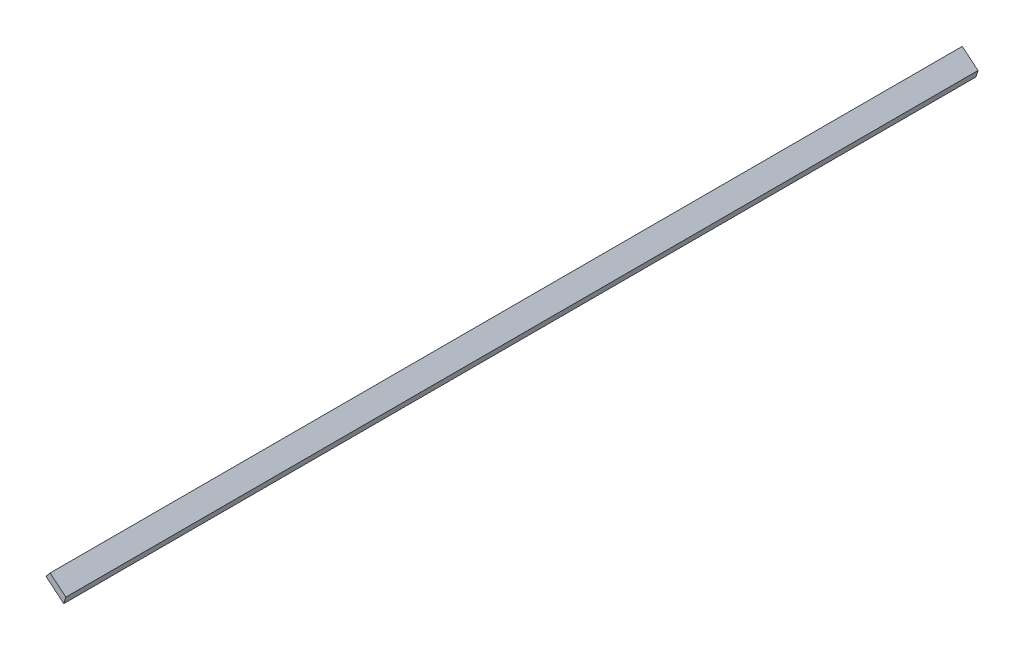
from build123d import *

# Parameters (mm, degrees)
BOSS_EXTRUDE1_DEPTH = 895.35


with BuildPart() as part:
    # Sketch1 → Boss-Extrude1 (new body)
    with BuildSketch(Plane.XY):
        Polygon((0, 0), (2.044356691, 6.562114978), (-13.371154257, 19.407595826), (-17.436179842, 14.529269577), align=None)
    extrude(amount=BOSS_EXTRUDE1_DEPTH)


solid = part.part
